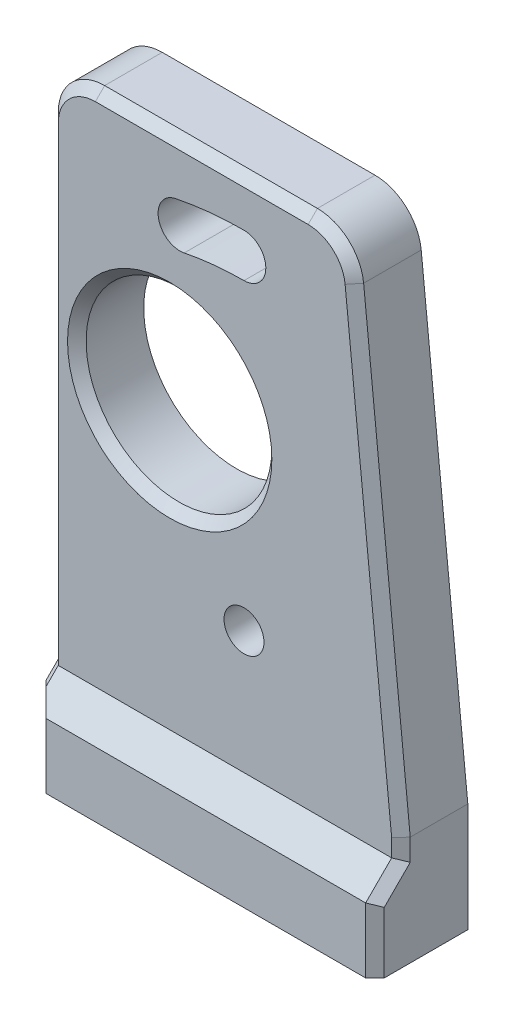
from build123d import *

# Parameters (mm, degrees)
AUFSATZ_LINEAR_AUSTRAGEN1_DEPTH      = 10
SKIZZE2_R                            = 1.5
SCHNITT_LINEAR_AUSTRAGEN1_DEPTH      = 8
SCHNITT_LINEAR_AUSTRAGEN3_DEPTH      = 2.8
SCHNITT_LINEAR_AUSTRAGEN5_DEPTH      = 72.591285383
SCHNITT_LINEAR_AUSTRAGEN5_DEPTH_BACK = 72.591285383
SKIZZE7_R                            = 10
FASE1_SIZE                           = 3
SCHNITT_LINEAR_AUSTRAGEN4_DEPTH      = 10
VERRUNDUNG1_R                        = 5
FASE2_SIZE                           = 1
FASE3_SIZE                           = 2.5
SKIZZE9_R                            = 2.15
SCHNITT_LINEAR_AUSTRAGEN7_DEPTH      = 71.291034025
SKIZZE10_R                           = 3.65
SCHNITT_LINEAR_AUSTRAGEN8_DEPTH      = 2.5
FASE4_SIZE                           = 1.5
SCHNITT_LINEAR_AUSTRAGEN9_DEPTH      = 10


# Some blends are built 0.0001 mm under size
with BuildPart() as part:
    # Skizze1 → Aufsatz-Linear austragen1 (new body)
    with BuildSketch(Plane.XY):
        Polygon((28.287001282, 57.370618027), (28.287001282, 0), (-13.088781156, 0), (-13.088781156, 27.348243657), (-13.088781156, 53.715647777), (-13.088781156, 57.370618027), (-13.088781156, 65.370618027), (28.287001282, 65.370618027), align=None)
    extrude(amount=AUFSATZ_LINEAR_AUSTRAGEN1_DEPTH)

    # Skizze2 → Schnitt-Linear austragen1 (cut)
    with BuildSketch(Plane.XZ):
        with Locations((-7, 5)):
            Circle(SKIZZE2_R)
        with Locations((6.18, 5)):
            Circle(SKIZZE2_R)
        with Locations((19.36, 5)):
            Circle(SKIZZE2_R)
    extrude(amount=-SCHNITT_LINEAR_AUSTRAGEN1_DEPTH, mode=Mode.SUBTRACT)

    # Skizze4 → Schnitt-Linear austragen3 (cut)
    with BuildSketch(Plane.XY.offset(10)):
        Polygon((-15.095168359, 10), (28.287001282, 10), (36.093332102, 46.989971623), (30.429094825, 65.957451721), (-16.081030445, 65.957451721), (-16.081030445, 27.753515123), align=None)
    extrude(amount=-SCHNITT_LINEAR_AUSTRAGEN3_DEPTH, mode=Mode.SUBTRACT)

    # Skizze7 → Schnitt-Linear austragen5 (cut, two sides: drawn at the far end of the back side and taken through both)
    with BuildSketch(Plane.XY.offset(7.2).offset(-SCHNITT_LINEAR_AUSTRAGEN5_DEPTH_BACK)):
        with Locations((-0.088781156, 40.531945717)):
            Circle(SKIZZE7_R)
    extrude(amount=SCHNITT_LINEAR_AUSTRAGEN5_DEPTH + SCHNITT_LINEAR_AUSTRAGEN5_DEPTH_BACK, mode=Mode.SUBTRACT)

    # Fase1
    # the kernel refuses this chamfer: 3 mm, written as the material it takes off along each edge
    with BuildSketch(Plane(origin=(-20.80383012, 10, 10), x_dir=(0, -0.9996219169112969, 0.027495876610586202), z_dir=(1, 0, 0))) as fase1_piece_1_section:
        Polygon((FASE1_SIZE * 0.999621916911, FASE1_SIZE * 0.0274958766106), (-FASE1_SIZE * 0.0274958766106, FASE1_SIZE * 0.999621916911), (0, 0), align=None)
    fase1_piece_1 = extrude(amount=56.805880365, mode=Mode.PRIVATE)
    fase1_piece_1 = split(fase1_piece_1, bisect_by=Plane(origin=(7.599110063, 8.999392985, 7.2), z_dir=(0, 0, 1)), keep=Keep.TOP, mode=Mode.PRIVATE)
    add(fase1_piece_1, mode=Mode.SUBTRACT)

    # Skizze5 → Schnitt-Linear austragen4 (cut)
    with BuildSketch(Plane(origin=(0, 0, 0), x_dir=(-1, 0, 0), z_dir=(0, 0, -1))):
        Polygon((-24.81273389, 11.736777957), (-19.336036603, 65.370618027), (-28.287001282, 65.370618027), (-28.287001282, 0), (-24.81273389, 0), align=None)
    extrude(amount=-SCHNITT_LINEAR_AUSTRAGEN4_DEPTH, mode=Mode.SUBTRACT)

    # Verrundung1
    verrundung1_edges = [part.edges().sort_by_distance(p)[0] for p in [
        (-13.088781156, 65.370618027, 3.6),
        (19.336036603, 65.370618027, 3.6),
    ]]
    fillet(verrundung1_edges, radius=VERRUNDUNG1_R)

    # Fase2
    fase2_edges = [part.edges().sort_by_distance(p)[0] for p in [
        (-13.088781156, 35.085309014, 7.2),
        (3.365909563, 65.370618027, 7.2),
        (22.303734377, 36.307659198, 7.2),
        (18.17174844, 64.081386954, 7.2),
        (-11.624315062, 63.906151933, 7.2),
        (-10.088781156, 40.531945717, 7.2),
        (-13.088781156, 8.4, 8.6),
        (24.81273389, 8.4, 8.6),
        (24.81273389, 10.768388979, 7.2),
        (24.81273389, 3.5, 10),
    ]]
    chamfer(fase2_edges, length=FASE2_SIZE)

    # Fase3
    fase3_edges = [part.edges().sort_by_distance(p)[0] for p in [
        (-13.088781156, 2.792893219, 10),
    ]]
    chamfer(fase3_edges, length=FASE3_SIZE)

    # Skizze9 → Schnitt-Linear austragen7 (cut, through all)
    with BuildSketch(Plane.XY.offset(7.2)):
        with Locations((7.911218844, 58.031945717)):
            Circle(SKIZZE9_R)
        with Locations((7.911218844, 23.031945717)):
            Circle(SKIZZE9_R)
    extrude(amount=-SCHNITT_LINEAR_AUSTRAGEN7_DEPTH, mode=Mode.SUBTRACT)

    # Skizze10 → Schnitt-Linear austragen8 (cut)
    with BuildSketch(Plane(origin=(0, 0, 0), x_dir=(-1, 0, 0), z_dir=(0, 0, -1))):
        with Locations((-7.911218844, 23.031945717)):
            Circle(SKIZZE10_R)
    extrude(amount=-SCHNITT_LINEAR_AUSTRAGEN8_DEPTH, mode=Mode.SUBTRACT)

    # Fase4
    fase4_edges = [part.edges().sort_by_distance(p)[0] for p in [
        (5.761218844, 23.031945717, 2.5),
    ]]
    chamfer(fase4_edges, length=FASE4_SIZE - 0.0001)  # a hair under: the kernel refuses the full size

    # Skizze11 → Schnitt-Linear austragen9 (cut)
    with BuildSketch(Plane.XY.offset(7.2)):
        with BuildLine():
            ThreePointArc((7.911218844, 60.381945717), (4.210709496, 60.198176768), (0.546614537, 59.648678277))
            ThreePointArc((0.546614537, 59.648678277), (-1.293880815, 56.88144557), (1.473351893, 55.040950218))
            ThreePointArc((1.473351893, 55.040950218), (4.676369307, 55.521301643), (7.911218844, 55.681945717))
            ThreePointArc((7.911218844, 55.681945717), (10.261218844, 58.031945717), (7.911218844, 60.381945717))
        make_face()
    extrude(amount=-SCHNITT_LINEAR_AUSTRAGEN9_DEPTH, mode=Mode.SUBTRACT)


solid = part.part
